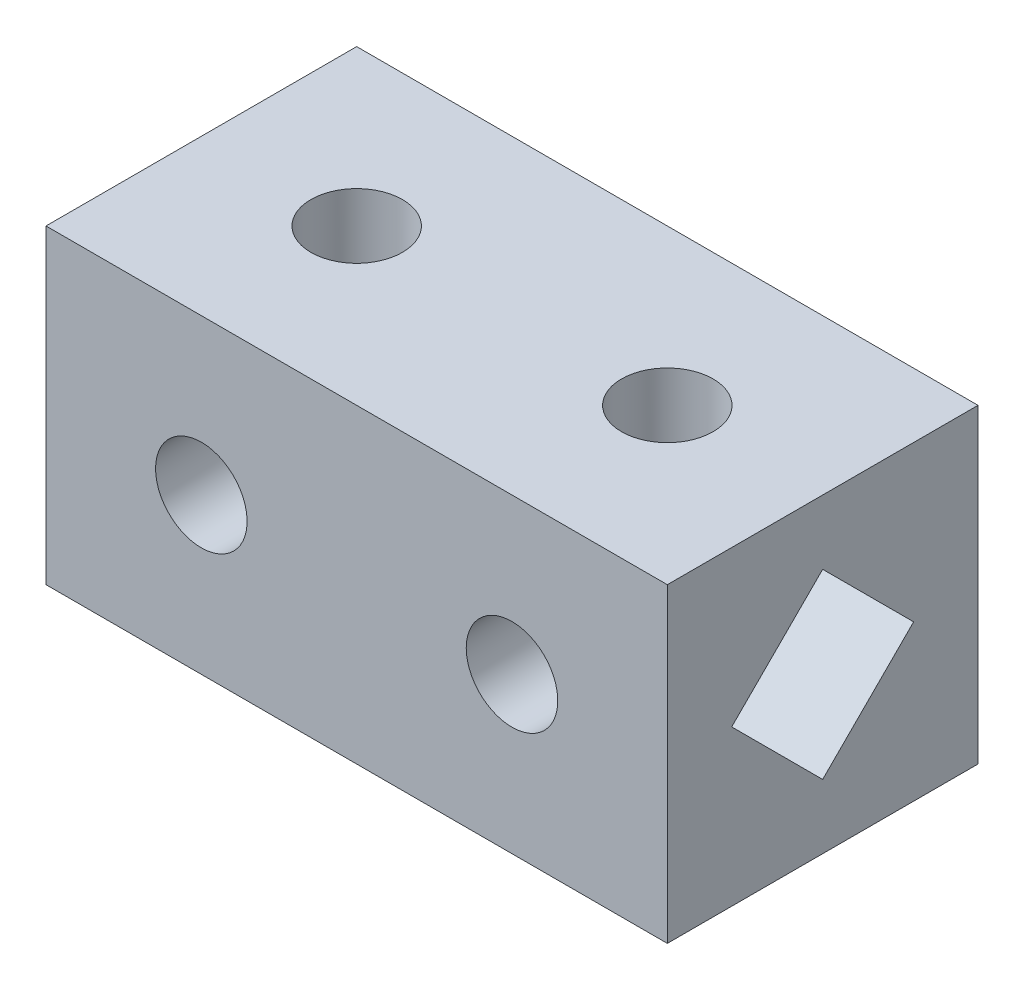
from build123d import *

# Parameters (mm, degrees)
SKETCH1_W           = 34
SKETCH1_H           = 17
SKETCH1_R           = 2.505
BOSS_EXTRUDE1_DEPTH = 17
SKETCH6_OUTSIDE_W   = 44.328
SKETCH6_OUTSIDE_H   = 27.328
SKETCH6_OUTSIDE_W_2 = 34
SKETCH6_OUTSIDE_H_2 = 17
SKETCH6_OUTSIDE_R   = 2.505
CUT_EXTRUDE10_DEPTH = 42.641325627
SKETCH7_OUTSIDE_W   = 27.328
SKETCH7_OUTSIDE_H   = 27.328
SKETCH7_OUTSIDE_W_2 = 17
SKETCH7_OUTSIDE_H_2 = 17
CUT_EXTRUDE11_DEPTH = 34


with BuildPart() as part:
    # sketch1 → Boss-Extrude1 (new body)
    with BuildSketch(Plane(origin=(0, 0, 0), x_dir=(1, 0, 0), z_dir=(0, 1, 0))):
        with Locations((17, -8.5)):
            Rectangle(SKETCH1_W, SKETCH1_H)
        with Locations((8.5, -8.5)):
            Circle(SKETCH1_R, mode=Mode.SUBTRACT)
        with Locations((25.5, -8.5)):
            Circle(SKETCH1_R, mode=Mode.SUBTRACT)
    extrude(amount=BOSS_EXTRUDE1_DEPTH)

    # Sketch6 outside → Cut-Extrude10 (cut, through all)
    # profile 1 of 3: a face of its own
    with BuildSketch(Plane(origin=(0, 0, 0), x_dir=(-1, 0, 0), z_dir=(0, 0, -1))):
        with Locations((-17, 8.5)):
            Rectangle(SKETCH6_OUTSIDE_W, SKETCH6_OUTSIDE_H)
        with Locations((-17, 8.5)):
            Rectangle(SKETCH6_OUTSIDE_W_2, SKETCH6_OUTSIDE_H_2, mode=Mode.SUBTRACT)
    # profile 2 of 3: a face of its own
    with BuildSketch(Plane(origin=(0, 0, 0), x_dir=(-1, 0, 0), z_dir=(0, 0, -1))):
        with Locations((-25.5, 8.5)):
            Circle(SKETCH6_OUTSIDE_R)
    # profile 3 of 3: a face of its own
    with BuildSketch(Plane(origin=(0, 0, 0), x_dir=(-1, 0, 0), z_dir=(0, 0, -1))):
        with Locations((-8.5, 8.5)):
            Circle(SKETCH6_OUTSIDE_R)
    extrude(amount=-CUT_EXTRUDE10_DEPTH, mode=Mode.SUBTRACT)

    # Sketch7 outside → Cut-Extrude11 (cut)
    # profile 1 of 2: a face of its own
    with BuildSketch(Plane(origin=(34, 0, 0), x_dir=(0, 0, -1), z_dir=(1, 0, 0))):
        with Locations((-8.5, 8.5)):
            Rectangle(SKETCH7_OUTSIDE_W, SKETCH7_OUTSIDE_H)
        with Locations((-8.5, 8.5)):
            Rectangle(SKETCH7_OUTSIDE_W_2, SKETCH7_OUTSIDE_H_2, mode=Mode.SUBTRACT)
    # profile 2 of 2: a face of its own
    with BuildSketch(Plane(origin=(34, 0, 0), x_dir=(0, 0, -1), z_dir=(1, 0, 0))):
        Polygon((-8.5, 13.47803174), (-3.52196826, 8.5), (-8.5, 3.52196826), (-13.47803174, 8.5), align=None)
    extrude(amount=-CUT_EXTRUDE11_DEPTH, mode=Mode.SUBTRACT)


solid = part.part
